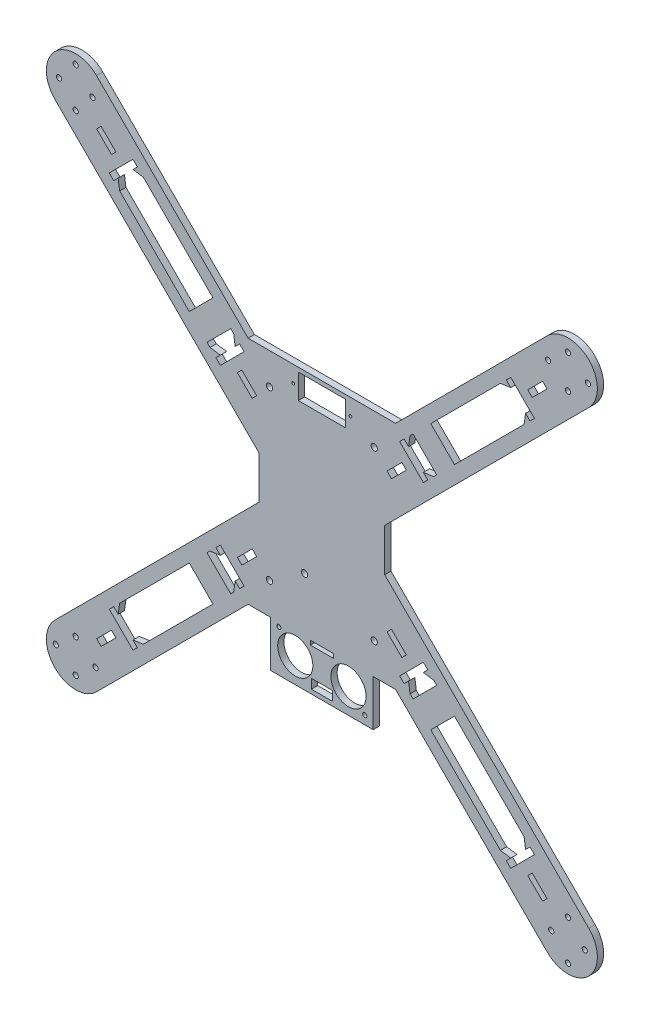
from build123d import *

# Parameters (mm, degrees)
BOSS_EXTRUDE1_DEPTH = 3
SKETCH4_R           = 1.5
SKETCH4_R_2         = 1.25
CUT_EXTRUDE1_DEPTH  = 3
SKETCH5_R           = 0.65
SKETCH5_W           = 22.5
SKETCH5_H           = 11.8
CUT_EXTRUDE2_DEPTH  = 3
SKETCH6_R           = 1.5
CUT_EXTRUDE3_DEPTH  = 3
SKETCH7_R           = 1
SKETCH7_R_2         = 8.4
SKETCH7_W           = 11
SKETCH7_H           = 2
SKETCH7_W_2         = 10
SKETCH7_H_2         = 4.5
CUT_EXTRUDE4_DEPTH  = 3
CUT_EXTRUDE5_DEPTH  = 186.993279448
BOSS_EXTRUDE2_REACH = 195.992
SKETCH9_W           = 3
SKETCH9_H           = 12
BOSS_EXTRUDE3_REACH = 195.992
SKETCH11_W          = 3
SKETCH11_H          = 12
BOSS_EXTRUDE4_REACH = 195.992
SKETCH12_W          = 3
SKETCH12_H          = 12
BOSS_EXTRUDE5_REACH = 195.992
SKETCH13_W          = 3
SKETCH13_H          = 12


with BuildPart() as part:
    # Sketch1 → Boss-Extrude1 (new body)
    with BuildSketch(Plane.XY):
        with BuildLine():
            Line((35.201010127, 55), (-35.201010127, 55))
            Line((-35.201010127, 55), (-107.600505063, 127.399494937))
            ThreePointArc((-107.600505063, 127.399494937), (-127.399494937, 127.399494937), (-127.399494937, 107.600505063))
            Line((-127.399494937, 107.600505063), (-30, 10.201010127))
            Line((-30, 10.201010127), (-30, -10.201010127))
            Line((-30, -10.201010127), (-127.399494937, -107.600505063))
            ThreePointArc((-127.399494937, -107.600505063), (-127.399494937, -127.399494937), (-107.600505063, -127.399494937))
            Line((-107.600505063, -127.399494937), (-35.201010127, -55))
            Line((-35.201010127, -55), (-24.5, -55))
            Line((-24.5, -55), (-24.5, -77))
            Line((-24.5, -77), (24.5, -77))
            Line((24.5, -77), (24.5, -55))
            Line((24.5, -55), (35.201010127, -55))
            Line((35.201010127, -55), (107.600505063, -127.399494937))
            ThreePointArc((107.600505063, -127.399494937), (127.399494937, -127.399494937), (127.399494937, -107.600505063))
            Line((127.399494937, -107.600505063), (30, -10.201010127))
            Line((30, -10.201010127), (30, 10.201010127))
            Line((30, 10.201010127), (127.399494937, 107.600505063))
            ThreePointArc((127.399494937, 107.600505063), (127.399494937, 127.399494937), (107.600505063, 127.399494937))
            Line((107.600505063, 127.399494937), (35.201010127, 55))
        make_face()
    extrude(amount=-BOSS_EXTRUDE1_DEPTH)

    # Sketch4 → Cut-Extrude1 (cut)
    with BuildSketch(Plane.XY):
        with Locations((-25, 40)):
            Circle(SKETCH4_R)
        with Locations((-25, -40)):
            Circle(SKETCH4_R)
        with Locations((25, -40)):
            Circle(SKETCH4_R)
        with Locations((25, 40)):
            Circle(SKETCH4_R)
        with Locations((-117.5, 127)):
            Circle(SKETCH4_R_2)
        with Locations((-117.5, 108)):
            Circle(SKETCH4_R_2)
        with Locations((-125.5, 117.5)):
            Circle(SKETCH4_R_2)
        with Locations((-109.5, 117.5)):
            Circle(SKETCH4_R_2)
        with Locations((117.5, 109.5)):
            Circle(SKETCH4_R_2)
        with Locations((108, 117.5)):
            Circle(SKETCH4_R_2)
        with Locations((117.5, 125.5)):
            Circle(SKETCH4_R_2)
        with Locations((127, 117.5)):
            Circle(SKETCH4_R_2)
        with Locations((109.5, -117.5)):
            Circle(SKETCH4_R_2)
        with Locations((117.5, -108)):
            Circle(SKETCH4_R_2)
        with Locations((125.5, -117.5)):
            Circle(SKETCH4_R_2)
        with Locations((117.5, -127)):
            Circle(SKETCH4_R_2)
        with Locations((-117.5, -109.5)):
            Circle(SKETCH4_R_2)
        with Locations((-108, -117.5)):
            Circle(SKETCH4_R_2)
        with Locations((-117.5, -125.5)):
            Circle(SKETCH4_R_2)
        with Locations((-127, -117.5)):
            Circle(SKETCH4_R_2)
    extrude(amount=-CUT_EXTRUDE1_DEPTH, mode=Mode.SUBTRACT)

    # Sketch5 → Cut-Extrude2 (cut)
    with BuildSketch(Plane.XY):
        with Locations((-13.65, 47.1)):
            Circle(SKETCH5_R)
        with Locations((13.65, 47.1)):
            Circle(SKETCH5_R)
        with Locations((0, 47.1)):
            Rectangle(SKETCH5_W, SKETCH5_H)
    extrude(amount=-CUT_EXTRUDE2_DEPTH, mode=Mode.SUBTRACT)

    # Sketch6 → Cut-Extrude3 (cut)
    with BuildSketch(Plane.XY):
        with Locations((-8.25, -28.8)):
            Circle(SKETCH6_R)
    extrude(amount=-CUT_EXTRUDE3_DEPTH, mode=Mode.SUBTRACT)

    # Sketch7 → Cut-Extrude4 (cut)
    with BuildSketch(Plane.XY):
        with Locations((-20.5, -57)):
            Circle(SKETCH7_R)
        with Locations((-12.7, -65)):
            Circle(SKETCH7_R_2)
        with Locations((12.7, -65)):
            Circle(SKETCH7_R_2)
        with Locations((20.5, -73)):
            Circle(SKETCH7_R)
        with Locations((0, -56)):
            Rectangle(SKETCH7_W, SKETCH7_H)
        with Locations((0, -72.75)):
            Rectangle(SKETCH7_W_2, SKETCH7_H_2)
    extrude(amount=-CUT_EXTRUDE4_DEPTH, mode=Mode.SUBTRACT)

    # Sketch8 → Cut-Extrude5 (cut, through all)
    with BuildSketch(Plane.XY):
        Polygon((101.47918472, -90.165476221), (90.165476221, -101.47918472), (88.044155877, -99.357864376), (90.165476221, -97.236544033), (85.215728753, -96.529437252), (42.0822151, -53.395923599), (41.375108319, -48.446176131), (39.253787975, -50.567496474), (37.132467632, -48.446176131), (48.446176131, -37.132467632), (50.567496474, -39.253787975), (48.446176131, -41.375108319), (53.395923599, -42.0822151), (96.529437252, -85.215728753), (97.236544033, -90.165476221), (99.357864376, -88.044155877), align=None)
        Polygon((40.314448147, -38.193127804), (38.193127804, -40.314448147), (31.122059992, -33.243380335), (33.243380335, -31.122059992), align=None)
        Polygon((50.567496474, 39.253787975), (48.446176131, 37.132467632), (37.132467632, 48.446176131), (39.253787975, 50.567496474), (41.375108319, 48.446176131), (42.0822151, 53.395923599), (85.215728753, 96.529437252), (90.165476221, 97.236544033), (88.044155877, 99.357864376), (90.165476221, 101.47918472), (101.47918472, 90.165476221), (99.357864376, 88.044155877), (97.236544033, 90.165476221), (96.529437252, 85.215728753), (53.395923599, 42.0822151), (48.446176131, 41.375108319), align=None)
        Polygon((100.418524548, -98.297204204), (98.297204204, -100.418524548), (105.368272016, -107.48959236), (107.48959236, -105.368272016), align=None)
        Polygon((-101.47918472, -90.165476221), (-99.357864376, -88.044155877), (-97.236544033, -90.165476221), (-96.529437252, -85.215728753), (-53.395923599, -42.0822151), (-48.446176131, -41.375108319), (-50.567496474, -39.253787975), (-48.446176131, -37.132467632), (-37.132467632, -48.446176131), (-39.253787975, -50.567496474), (-41.375108319, -48.446176131), (-42.0822151, -53.395923599), (-85.215728753, -96.529437252), (-90.165476221, -97.236544033), (-88.044155877, -99.357864376), (-90.165476221, -101.47918472), align=None)
        Polygon((-100.418524548, -98.297204204), (-107.48959236, -105.368272016), (-105.368272016, -107.48959236), (-98.297204204, -100.418524548), align=None)
        Polygon((-38.193127804, -40.314448147), (-40.314448147, -38.193127804), (-33.243380335, -31.122059992), (-31.122059992, -33.243380335), align=None)
        Polygon((-90.165476221, 101.47918472), (-88.044155877, 99.357864376), (-90.165476221, 97.236544033), (-85.215728753, 96.529437252), (-42.0822151, 53.395923599), (-41.375108319, 48.446176131), (-39.253787975, 50.567496474), (-37.132467632, 48.446176131), (-48.446176131, 37.132467632), (-50.567496474, 39.253787975), (-48.446176131, 41.375108319), (-53.395923599, 42.0822151), (-96.529437252, 85.215728753), (-97.236544033, 90.165476221), (-99.357864376, 88.044155877), (-101.47918472, 90.165476221), align=None)
        Polygon((-98.297204204, 100.418524548), (-105.368272016, 107.48959236), (-107.48959236, 105.368272016), (-100.418524548, 98.297204204), align=None)
        Polygon((-40.314448147, 38.193127804), (-38.193127804, 40.314448147), (-31.122059992, 33.243380335), (-33.243380335, 31.122059992), align=None)
        Polygon((100.418524548, 98.297204204), (107.48959236, 105.368272016), (105.368272016, 107.48959236), (98.297204204, 100.418524548), align=None)
        Polygon((38.193127804, 40.314448147), (40.314448147, 38.193127804), (33.243380335, 31.122059992), (31.122059992, 33.243380335), align=None)
    extrude(amount=-CUT_EXTRUDE5_DEPTH, mode=Mode.SUBTRACT)

    # Sketch9 → Boss-Extrude2 (add, up to next)
    with BuildSketch(Plane(origin=(-5.656854249, 5.656854249, 0), x_dir=(0, 0, -1), z_dir=(0.70710678118654, -0.707106781186555, 0)), mode=Mode.PRIVATE) as boss_extrude2_sk1:
        with Locations((1.5, 75.513239329)):
            Rectangle(SKETCH9_W, SKETCH9_H)
    boss_extrude2_tool1 = extrude(boss_extrude2_sk1.sketch, amount=BOSS_EXTRUDE2_REACH, mode=Mode.PRIVATE) - part.part
    add(boss_extrude2_tool1.solids().sort_by_distance((47.739069, 59.052778, -1.5))[0])

    # Sketch11 → Boss-Extrude3 (add, up to next)
    with BuildSketch(Plane(origin=(5.656854249, 5.656854249, 0), x_dir=(0, 0, 1), z_dir=(-0.7071067811865477, -0.7071067811865475, 0)), mode=Mode.PRIVATE) as boss_extrude3_sk1:
        with Locations((-1.5, -75.513239329)):
            Rectangle(SKETCH11_W, SKETCH11_H)
    boss_extrude3_tool1 = extrude(boss_extrude3_sk1.sketch, amount=BOSS_EXTRUDE3_REACH, mode=Mode.PRIVATE) - part.part
    add(boss_extrude3_tool1.solids().sort_by_distance((59.052778, -47.739069, -1.5))[0])

    # Sketch12 → Boss-Extrude4 (add, up to next)
    with BuildSketch(Plane(origin=(5.656854249, -5.656854249, 0), x_dir=(0, 0, 1), z_dir=(-0.7071067811865449, 0.7071067811865502, 0)), mode=Mode.PRIVATE) as boss_extrude4_sk1:
        with Locations((-1.5, -75.513239329)):
            Rectangle(SKETCH12_W, SKETCH12_H)
    boss_extrude4_tool1 = extrude(boss_extrude4_sk1.sketch, amount=BOSS_EXTRUDE4_REACH, mode=Mode.PRIVATE) - part.part
    add(boss_extrude4_tool1.solids().sort_by_distance((-47.739069, -59.052778, -1.5))[0])

    # Sketch13 → Boss-Extrude5 (add, up to next)
    with BuildSketch(Plane(origin=(5.656854249, 5.656854249, 0), x_dir=(0, 0, 1), z_dir=(-0.707106781186552, -0.707106781186543, 0)), mode=Mode.PRIVATE) as boss_extrude5_sk1:
        with Locations((-1.5, 75.513239329)):
            Rectangle(SKETCH13_W, SKETCH13_H)
    boss_extrude5_tool1 = extrude(boss_extrude5_sk1.sketch, amount=BOSS_EXTRUDE5_REACH, mode=Mode.PRIVATE) - part.part
    add(boss_extrude5_tool1.solids().sort_by_distance((-47.739069, 59.052778, -1.5))[0])


solid = part.part
